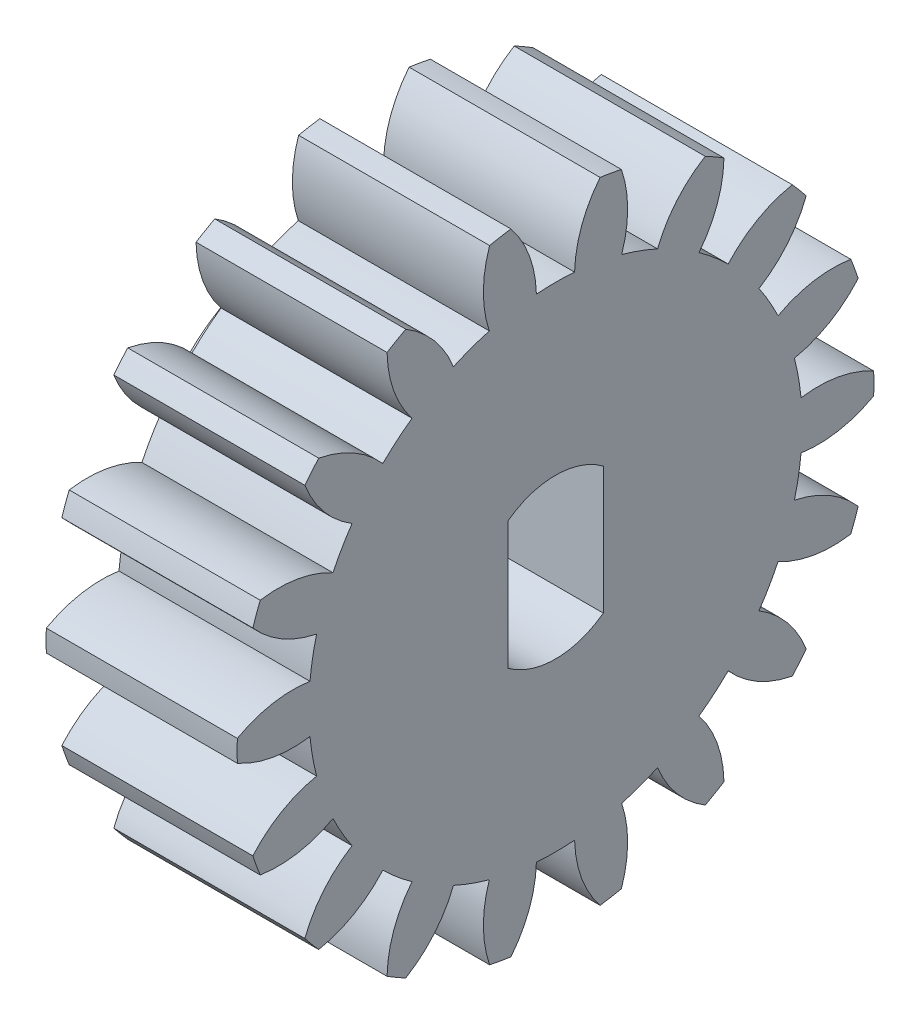
from build123d import *

# Parameters (mm, degrees)
SPUR_START                  = -26.948632746
SPUR_GEAR_ISO_OUTLINE_R     = 2.5
SPUR_GEAR_ISO_DEPTH         = 6
SPUR_START_2                = -28.948683546
SPUR_GEAR_ISO_2_OUTLINE_R   = 5
SPUR_GEAR_ISO_2_OUTLINE_R_2 = 2.5
SPUR_GEAR_ISO_2_DEPTH       = 2.0000508
BOSS_EXTRUDE1_DEPTH         = 8.0000508


# Read off the part's stored shape, not the designer's step: spur gear_iso
with BuildPart() as part:
    # spur gear_iso outline → spur gear_iso (new body)
    with BuildSketch(Plane.YZ.offset(SPUR_START)):
        with BuildLine():
            ThreePointArc((9.06624461, 20.039929061), (8.809867644, 20.262580741), (8.54607915, 20.476399706))
            ThreePointArc((8.54607915, 20.476399706), (7.532383697, 19.882145035), (6.764050297, 18.993111362))
            ThreePointArc((6.764050297, 18.993111362), (6.256491547, 19.312967164), (5.725708923, 19.592598034))
            ThreePointArc((5.725708923, 19.592598034), (6.111467968, 20.702511114), (6.119259883, 21.877524463))
            ThreePointArc((6.119259883, 21.877524463), (5.802192981, 21.999062518), (5.481182486, 22.109765643))
            ThreePointArc((5.481182486, 22.109765643), (4.731867417, 21.20464465), (4.313937615, 20.106440768))
            ThreePointArc((4.313937615, 20.106440768), (3.727591276, 20.233411588), (3.13317937, 20.314640304))
            ThreePointArc((3.13317937, 20.314640304), (3.116061668, 21.489554798), (2.721505439, 22.596371164))
            ThreePointArc((2.721505439, 22.596371164), (2.381991548, 22.60213631), (2.042477656, 22.596371164))
            ThreePointArc((2.042477656, 22.596371164), (1.647921427, 21.489554798), (1.630803724, 20.314640304))
            ThreePointArc((1.630803724, 20.314640304), (1.036391818, 20.233411588), (0.45004548, 20.106440768))
            ThreePointArc((0.45004548, 20.106440768), (0.032115678, 21.20464465), (-0.717199391, 22.109765643))
            ThreePointArc((-0.717199391, 22.109765643), (-1.038209886, 21.999062518), (-1.355276788, 21.877524463))
            ThreePointArc((-1.355276788, 21.877524463), (-1.347484873, 20.702511114), (-0.961725828, 19.592598034))
            ThreePointArc((-0.961725828, 19.592598034), (-1.492508453, 19.312967164), (-2.000067202, 18.993111362))
            ThreePointArc((-2.000067202, 18.993111362), (-2.768400602, 19.882145035), (-3.782096055, 20.476399706))
            ThreePointArc((-3.782096055, 20.476399706), (-4.045884549, 20.262580741), (-4.302261515, 20.039929061))
            ThreePointArc((-4.302261515, 20.039929061), (-3.893061276, 18.938442679), (-3.150953717, 18.027402912))
            ThreePointArc((-3.150953717, 18.027402912), (-3.554086842, 17.583097498), (-3.921638927, 17.108936045))
            ThreePointArc((-3.921638927, 17.108936045), (-4.947703578, 17.681568927), (-6.103512782, 17.893281392))
            ThreePointArc((-6.103512782, 17.893281392), (-6.27826249, 17.60213631), (-6.443026673, 17.305226082))
            ThreePointArc((-6.443026673, 17.305226082), (-5.681773697, 16.410122182), (-4.672826749, 15.807840569))
            ThreePointArc((-4.672826749, 15.807840569), (-4.899686571, 15.252450401), (-5.082899784, 14.681174166))
            ThreePointArc((-5.082899784, 14.681174166), (-6.242937146, 14.868338281), (-7.401452454, 14.671972892))
            ThreePointArc((-7.401452454, 14.671972892), (-7.466085983, 14.338618087), (-7.519364391, 14.003261067))
            ThreePointArc((-7.519364391, 14.003261067), (-6.497877023, 13.422502389), (-5.343784577, 13.201622982))
            ThreePointArc((-5.343784577, 13.201622982), (-5.367008453, 12.60213631), (-5.343784577, 12.002649638))
            ThreePointArc((-5.343784577, 12.002649638), (-6.497877023, 11.781770232), (-7.519364391, 11.201011553))
            ThreePointArc((-7.519364391, 11.201011553), (-7.466085983, 10.865654533), (-7.401452454, 10.532299728))
            ThreePointArc((-7.401452454, 10.532299728), (-6.242937146, 10.335934339), (-5.082899784, 10.523098454))
            ThreePointArc((-5.082899784, 10.523098454), (-4.899686571, 9.951822219), (-4.672826749, 9.396432051))
            ThreePointArc((-4.672826749, 9.396432051), (-5.681773698, 8.794150439), (-6.443026673, 7.899046538))
            ThreePointArc((-6.443026673, 7.899046538), (-6.27826249, 7.60213631), (-6.103512782, 7.310991228))
            ThreePointArc((-6.103512782, 7.310991228), (-4.947703577, 7.522703693), (-3.921638927, 8.095336576))
            ThreePointArc((-3.921638927, 8.095336576), (-3.554086842, 7.621175123), (-3.150953717, 7.176869708))
            ThreePointArc((-3.150953717, 7.176869708), (-3.893061276, 6.265829942), (-4.302261515, 5.16434356))
            ThreePointArc((-4.302261515, 5.16434356), (-4.045884549, 4.941691879), (-3.782096055, 4.727872914))
            ThreePointArc((-3.782096055, 4.727872914), (-2.768400602, 5.322127585), (-2.000067202, 6.211161258))
            ThreePointArc((-2.000067202, 6.211161258), (-1.492508453, 5.891305456), (-0.961725828, 5.611674586))
            ThreePointArc((-0.961725828, 5.611674586), (-1.347484873, 4.501761506), (-1.355276788, 3.326748157))
            ThreePointArc((-1.355276788, 3.326748157), (-1.038209886, 3.205210102), (-0.717199391, 3.094506978))
            ThreePointArc((-0.717199391, 3.094506978), (0.032115678, 3.999627971), (0.45004548, 5.097831853))
            ThreePointArc((0.45004548, 5.097831853), (1.036391818, 4.970861032), (1.630803724, 4.889632316))
            ThreePointArc((1.630803724, 4.889632316), (1.647921427, 3.714717822), (2.042477656, 2.607901456))
            ThreePointArc((2.042477656, 2.607901456), (2.381991548, 2.60213631), (2.721505439, 2.607901456))
            ThreePointArc((2.721505439, 2.607901456), (3.116061668, 3.714717822), (3.13317937, 4.889632316))
            ThreePointArc((3.13317937, 4.889632316), (3.727591276, 4.970861032), (4.313937615, 5.097831853))
            ThreePointArc((4.313937615, 5.097831853), (4.731867417, 3.999627971), (5.481182486, 3.094506978))
            ThreePointArc((5.481182486, 3.094506978), (5.802192981, 3.205210102), (6.119259883, 3.326748157))
            ThreePointArc((6.119259883, 3.326748157), (6.111467968, 4.501761506), (5.725708923, 5.611674586))
            ThreePointArc((5.725708923, 5.611674586), (6.256491547, 5.891305456), (6.764050297, 6.211161258))
            ThreePointArc((6.764050297, 6.211161258), (7.532383697, 5.322127585), (8.54607915, 4.727872914))
            ThreePointArc((8.54607915, 4.727872914), (8.809867644, 4.941691879), (9.06624461, 5.16434356))
            ThreePointArc((9.06624461, 5.16434356), (8.657044371, 6.265829942), (7.914936812, 7.176869708))
            ThreePointArc((7.914936812, 7.176869708), (8.318069937, 7.621175123), (8.685622021, 8.095336576))
            ThreePointArc((8.685622021, 8.095336576), (9.711686672, 7.522703693), (10.867495877, 7.310991228))
            ThreePointArc((10.867495877, 7.310991228), (11.042245585, 7.60213631), (11.207009768, 7.899046538))
            ThreePointArc((11.207009768, 7.899046538), (10.445756793, 8.794150439), (9.436809844, 9.396432051))
            ThreePointArc((9.436809844, 9.396432051), (9.663669666, 9.951822219), (9.846882879, 10.523098454))
            ThreePointArc((9.846882879, 10.523098454), (11.006920241, 10.335934339), (12.165435549, 10.532299728))
            ThreePointArc((12.165435549, 10.532299728), (12.230069078, 10.865654533), (12.283347486, 11.201011553))
            ThreePointArc((12.283347486, 11.201011553), (11.261860118, 11.781770232), (10.107767672, 12.002649638))
            ThreePointArc((10.107767672, 12.002649638), (10.130991547, 12.60213631), (10.107767672, 13.201622982))
            ThreePointArc((10.107767672, 13.201622982), (11.261860118, 13.422502389), (12.283347486, 14.003261067))
            ThreePointArc((12.283347486, 14.003261067), (12.230069078, 14.338618087), (12.165435549, 14.671972892))
            ThreePointArc((12.165435549, 14.671972892), (11.006920241, 14.868338281), (9.846882879, 14.681174166))
            ThreePointArc((9.846882879, 14.681174166), (9.663669666, 15.252450401), (9.436809844, 15.807840569))
            ThreePointArc((9.436809844, 15.807840569), (10.445756792, 16.410122182), (11.207009768, 17.305226082))
            ThreePointArc((11.207009768, 17.305226082), (11.042245585, 17.60213631), (10.867495877, 17.893281392))
            ThreePointArc((10.867495877, 17.893281392), (9.711686672, 17.681568927), (8.685622021, 17.108936045))
            ThreePointArc((8.685622021, 17.108936045), (8.318069937, 17.583097498), (7.914936812, 18.027402912))
            ThreePointArc((7.914936812, 18.027402912), (8.657044371, 18.938442679), (9.06624461, 20.039929061))
        make_face()
        with Locations((2.381991547, 12.60213631)):
            Circle(SPUR_GEAR_ISO_OUTLINE_R, mode=Mode.SUBTRACT)
    extrude(amount=SPUR_GEAR_ISO_DEPTH)

    # spur gear_iso 2 outline → spur gear_iso 2 (add)
    with BuildSketch(Plane.YZ.offset(SPUR_START_2)):
        with Locations((2.381991547, 12.60213631)):
            Circle(SPUR_GEAR_ISO_2_OUTLINE_R)
        with Locations((2.381991547, 12.60213631)):
            Circle(SPUR_GEAR_ISO_2_OUTLINE_R_2, mode=Mode.SUBTRACT)
    extrude(amount=SPUR_GEAR_ISO_2_DEPTH)

    # Sketch1 → Boss-Extrude1 (add)
    with BuildSketch(Plane.ZY.offset(28.948683546)):
        with BuildLine():
            Line((11.10213631, 0.381991547), (11.10213631, 4.381991547))
            ThreePointArc((11.10213631, 4.381991547), (10.10213631, 2.381991547), (11.10213631, 0.381991547))
        make_face()
        with BuildLine():
            ThreePointArc((15.10213631, 2.381991547), (14.838204288, 3.500025536), (14.10213631, 4.381991547))
            Line((14.10213631, 4.381991547), (14.10213631, 0.381991547))
            ThreePointArc((14.10213631, 0.381991547), (14.838204288, 1.263957559), (15.10213631, 2.381991547))
        make_face()
    extrude(amount=-BOSS_EXTRUDE1_DEPTH)


solid = part.part
